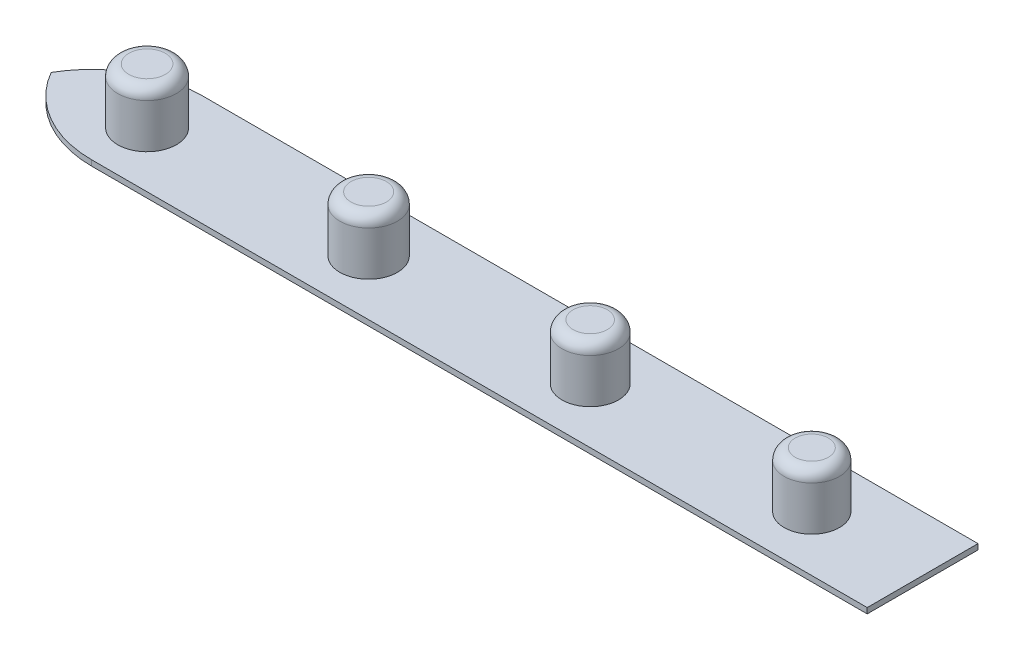
from build123d import *

# Parameters (mm, degrees)
SKETCH2_W           = 80
SKETCH2_H           = 10
BOSS_EXTRUDE1_DEPTH = 0.5
SKETCH3_R           = 2.65
SKETCH3_R_2         = 2.6
SKETCH3_R_3         = 2.55
SKETCH3_R_4         = 2.5
BOSS_EXTRUDE2_DEPTH = 5
FILLET1_R           = 1
FILLET2_R           = 10


with BuildPart() as part:
    # Sketch2 → Boss-Extrude1 (new body)
    with BuildSketch(Plane(origin=(0, 0, 0), x_dir=(1, 0, 0), z_dir=(0, 1, 0))):
        Rectangle(SKETCH2_W, SKETCH2_H)
    extrude(amount=BOSS_EXTRUDE1_DEPTH)

    # Sketch3 → Boss-Extrude2 (add)
    with BuildSketch(Plane(origin=(0, 0.5, 0), x_dir=(1, 0, 0), z_dir=(0, 1, 0))):
        with Locations(Location((-30, 0, 0), (0, 0, 270))):
            Circle(SKETCH3_R)
        with Locations(Location((-10, 0, 0), (0, 0, 270))):
            Circle(SKETCH3_R_2)
        with Locations(Location((10, 0, 0), (0, 0, 270))):
            Circle(SKETCH3_R_3)
        with Locations(Location((30, 0, 0), (0, 0, 270))):
            Circle(SKETCH3_R_4)
    extrude(amount=BOSS_EXTRUDE2_DEPTH)

    # Fillet1
    fillet1_edges = [part.edges().sort_by_distance(p)[0] for p in [
        (-30, 5.5, -2.65),
        (-10, 5.5, -2.6),
        (10, 5.5, -2.55),
        (30, 5.5, -2.5),
    ]]
    fillet(fillet1_edges, radius=FILLET1_R)

    # Fillet2
    # the kernel refuses this fillet: 10 mm, written as the material it takes off along each edge
    with BuildSketch(Plane(origin=(-40, -25, -5), x_dir=(1, 0, 0), z_dir=(0, 1, 0)), Plane(origin=(-40, -25, 5), x_dir=(0, 0, -1), z_dir=(0, 1, 0))) as fillet2_piece_1:
        with BuildLine():
            CenterArc((FILLET2_R, -FILLET2_R), FILLET2_R, 90, 90)
            Line((0, -FILLET2_R), (0, 0))
            Line((0, 0), (FILLET2_R, 0))
        make_face()
    extrude(amount=50.5, mode=Mode.SUBTRACT)


solid = part.part
